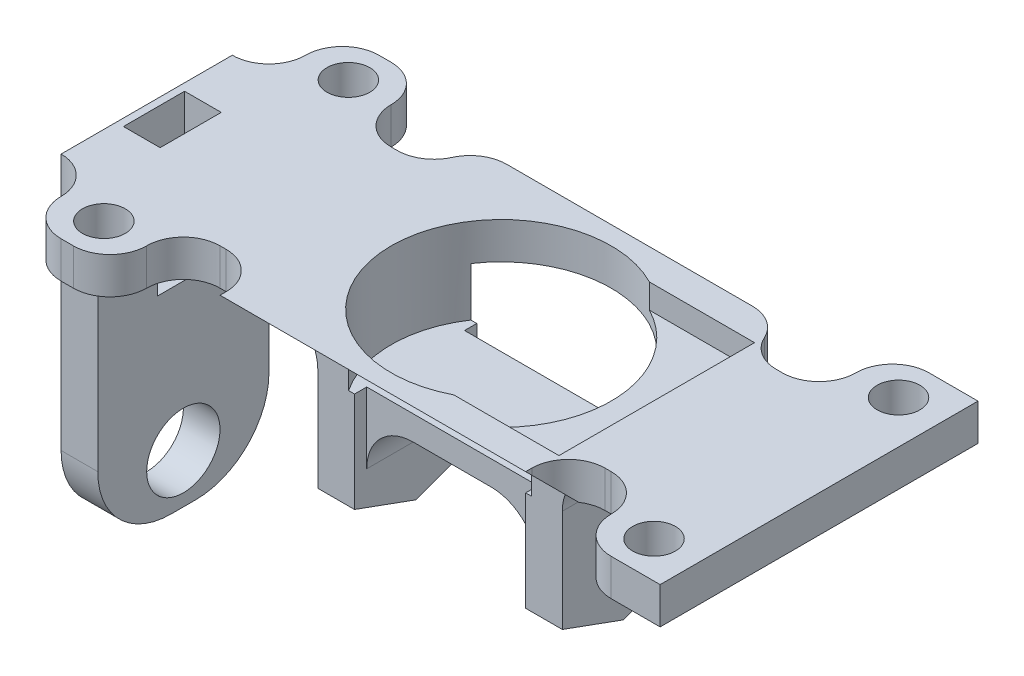
from build123d import *
from OCP.BRepFilletAPI import BRepFilletAPI_MakeChamfer

# Parameters (mm, degrees)
SKETCH1_W           = 3
SKETCH1_H           = 14
BOSS_EXTRUDE1_DEPTH = 27
SKETCH2_R           = 3
CUT_EXTRUDE1_DEPTH  = 29.053520278
SKETCH3_W           = 14
SKETCH3_H           = 3
BOSS_EXTRUDE2_DEPTH = 52
SKETCH4_W           = 3
SKETCH4_H           = 10
BOSS_EXTRUDE3_DEPTH = 14
CHAMFER1_SIZE       = 1.819851171
CHAMFER1_SIZE_2     = 5
SKETCH6_W           = 25
SKETCH6_H           = 3
BOSS_EXTRUDE5_DEPTH = 3.5
SKETCH5_W           = 7
SKETCH5_H           = 3
BOSS_EXTRUDE4_DEPTH = 6
SKETCH7_R           = 9
CUT_EXTRUDE2_DEPTH  = 7
CHAMFER2_SIZE       = 3
SKETCH8_W           = 8
SKETCH8_H           = 2
BOSS_EXTRUDE6_DEPTH = 14
SKETCH9_W           = 8.6
SKETCH9_H           = 16
CUT_EXTRUDE3_DEPTH  = 2
CUT_EXTRUDE4_REACH  = 63.321
SKETCH10_R          = 1.75
SKETCH11_W          = 1.8
SKETCH11_H          = 4.2
CUT_EXTRUDE5_DEPTH  = 11
FILLET1_R           = 3
FILLET2_R           = 3
FILLET3_R           = 3.8
FILLET4_R           = 6
SKETCH12_W          = 3
SKETCH12_H          = 5
CUT_EXTRUDE6_DEPTH  = 3


# Some blends are built 0.0001 mm under size
with BuildPart() as part:
    # Sketch1 → Boss-Extrude1 (new body)
    with BuildSketch(Plane(origin=(0, 0, 0), x_dir=(1, 0, 0), z_dir=(0, 1, 0))):
        Rectangle(SKETCH1_W, SKETCH1_H)
    extrude(amount=BOSS_EXTRUDE1_DEPTH)

    # Sketch2 → Cut-Extrude1 (cut, through all)
    with BuildSketch(Plane.ZY.offset(1.5)):
        with Locations((0, 4)):
            Circle(SKETCH2_R)
    extrude(amount=-CUT_EXTRUDE1_DEPTH, mode=Mode.SUBTRACT)

    # Sketch3 → Boss-Extrude2 (add)
    with BuildSketch(Plane(origin=(1.5, 0, 0), x_dir=(0, 0, -1), z_dir=(1, 0, 0))):
        with Locations((0, 25.5)):
            Rectangle(SKETCH3_W, SKETCH3_H)
    extrude(amount=BOSS_EXTRUDE2_DEPTH)

    # Sketch4 → Boss-Extrude3 (add)
    with BuildSketch(Plane.XZ.offset(-24)):
        with Locations((36, 0)):
            Rectangle(SKETCH4_W, SKETCH4_H)
        with Locations((19, 0)):
            Rectangle(SKETCH4_W, SKETCH4_H)
    extrude(amount=BOSS_EXTRUDE3_DEPTH)

    # Chamfer1
    chamfer1_edges_1 = [part.edges().sort_by_distance(p)[0] for p in [
        (36, 10, -5),
    ]]
    chamfer1_side_1 = [part.faces().sort_by_distance(p)[0] for p in [
        (36, 10.036397023, -5),
    ]]
    chamfer1_edges_2 = [part.edges().sort_by_distance(p)[0] for p in [
        (36, 10, 5),
    ]]
    chamfer1_side_2 = [part.faces().sort_by_distance(p)[0] for p in [
        (36, 10.036397023, 5),
    ]]
    chamfer1_edges_3 = [part.edges().sort_by_distance(p)[0] for p in [
        (19, 10, 5),
    ]]
    chamfer1_side_3 = [part.faces().sort_by_distance(p)[0] for p in [
        (19, 10.036397023, 5),
    ]]
    chamfer1_edges_4 = [part.edges().sort_by_distance(p)[0] for p in [
        (19, 10, -5),
    ]]
    chamfer1_side_4 = [part.faces().sort_by_distance(p)[0] for p in [
        (19, 10.036397023, -5),
    ]]
    chamfer1 = BRepFilletAPI_MakeChamfer(part.part.solid().wrapped)
    for e in chamfer1_edges_1:
        chamfer1.Add(CHAMFER1_SIZE - 0.0001, CHAMFER1_SIZE_2 - 0.0001, e.wrapped, chamfer1_side_1[0].wrapped)
    for e in chamfer1_edges_2:
        chamfer1.Add(CHAMFER1_SIZE - 0.0001, CHAMFER1_SIZE_2 - 0.0001, e.wrapped, chamfer1_side_2[0].wrapped)
    for e in chamfer1_edges_3:
        chamfer1.Add(CHAMFER1_SIZE - 0.0001, CHAMFER1_SIZE_2 - 0.0001, e.wrapped, chamfer1_side_3[0].wrapped)
    for e in chamfer1_edges_4:
        chamfer1.Add(CHAMFER1_SIZE - 0.0001, CHAMFER1_SIZE_2 - 0.0001, e.wrapped, chamfer1_side_4[0].wrapped)
    add(Compound.cast(chamfer1.Shape()), mode=Mode.REPLACE)  # a hair under: the kernel refuses the full size

    # Sketch6 → Boss-Extrude5 (add)
    with BuildSketch(Plane(origin=(0, 0, -7), x_dir=(-1, 0, 0), z_dir=(0, 0, -1))):
        with Locations((-27.5, 25.5)):
            Rectangle(SKETCH6_W, SKETCH6_H)
    boss_extrude5 = extrude(amount=BOSS_EXTRUDE5_DEPTH)

    # Sketch5 → Boss-Extrude4 (add)
    with BuildSketch(Plane.XY.offset(7)):
        with Locations((5, 25.5)):
            Rectangle(SKETCH5_W, SKETCH5_H)
        with Locations((50, 25.5)):
            Rectangle(SKETCH5_W, SKETCH5_H)
    boss_extrude4 = extrude(amount=BOSS_EXTRUDE4_DEPTH)

    # Mirror1: Boss-Extrude5, Boss-Extrude4 across plane
    add(boss_extrude5.mirror(Plane.XY))
    add(boss_extrude4.mirror(Plane.XY))

    # Sketch7 → Cut-Extrude2 (cut)
    with BuildSketch(Plane(origin=(0, 27, 0), x_dir=(1, 0, 0), z_dir=(0, 1, 0))):
        with Locations(Location((27.5, 0, 0), (0, 0, 270))):
            Circle(SKETCH7_R)
    extrude(amount=-CUT_EXTRUDE2_DEPTH, mode=Mode.SUBTRACT)

    # Chamfer2
    # the kernel refuses this chamfer: 3 mm, written as the material it takes off along each edge
    with BuildSketch(Plane(origin=(15, 24, 10.5), x_dir=(0, -0.027495876610586757, -0.9996219169112968), z_dir=(1, 0, 0))) as chamfer2_piece_1:
        Polygon((CHAMFER2_SIZE * 0.999621916911, CHAMFER2_SIZE * 0.0274958766106), (-CHAMFER2_SIZE * 0.0274958766106, CHAMFER2_SIZE * 0.999621916911), (0, 0), align=None)
    extrude(amount=25, mode=Mode.SUBTRACT)

    # Sketch8 → Boss-Extrude6 (add)
    with BuildSketch(Plane(origin=(20.5, 0, 0), x_dir=(0, 0, -1), z_dir=(1, 0, 0))):
        with Locations((0, 19)):
            Rectangle(SKETCH8_W, SKETCH8_H)
    extrude(amount=BOSS_EXTRUDE6_DEPTH)

    # Sketch9 → Cut-Extrude3 (cut)
    with BuildSketch(Plane(origin=(0, 27, 0), x_dir=(1, 0, 0), z_dir=(0, 1, 0))):
        with Locations((35.923105626, 0)):
            Rectangle(SKETCH9_W, SKETCH9_H)
    extrude(amount=-CUT_EXTRUDE3_DEPTH, mode=Mode.SUBTRACT)

    # Sketch10 → Cut-Extrude4 (cut, up to next)
    with BuildSketch(Plane(origin=(0, 27, 0), x_dir=(1, 0, 0), z_dir=(0, 1, 0)), mode=Mode.PRIVATE) as cut_extrude4_sk1:
        with Locations(Location((5, -10, 0), (0, 0, 270))):
            Circle(SKETCH10_R)
    cut_extrude4_tool1 = extrude(cut_extrude4_sk1.sketch, amount=-CUT_EXTRUDE4_REACH, mode=Mode.PRIVATE) & part.part
    # Sketch10 → Cut-Extrude4 (cut, up to next)
    with BuildSketch(Plane(origin=(0, 27, 0), x_dir=(1, 0, 0), z_dir=(0, 1, 0)), mode=Mode.PRIVATE) as cut_extrude4_sk2:
        with Locations(Location((50, -10, 0), (0, 0, 270))):
            Circle(SKETCH10_R)
    cut_extrude4_tool2 = extrude(cut_extrude4_sk2.sketch, amount=-CUT_EXTRUDE4_REACH, mode=Mode.PRIVATE) & part.part
    # Sketch10 → Cut-Extrude4 (cut, up to next)
    with BuildSketch(Plane(origin=(0, 27, 0), x_dir=(1, 0, 0), z_dir=(0, 1, 0)), mode=Mode.PRIVATE) as cut_extrude4_sk3:
        with Locations(Location((50, 10, 0), (0, 0, 270))):
            Circle(SKETCH10_R)
    cut_extrude4_tool3 = extrude(cut_extrude4_sk3.sketch, amount=-CUT_EXTRUDE4_REACH, mode=Mode.PRIVATE) & part.part
    # Sketch10 → Cut-Extrude4 (cut, up to next)
    with BuildSketch(Plane(origin=(0, 27, 0), x_dir=(1, 0, 0), z_dir=(0, 1, 0)), mode=Mode.PRIVATE) as cut_extrude4_sk4:
        with Locations(Location((5, 10, 0), (0, 0, 270))):
            Circle(SKETCH10_R)
    cut_extrude4_tool4 = extrude(cut_extrude4_sk4.sketch, amount=-CUT_EXTRUDE4_REACH, mode=Mode.PRIVATE) & part.part
    add(cut_extrude4_tool1.solids().sort_by_distance((5, 27, 10))[0], mode=Mode.SUBTRACT)
    add(cut_extrude4_tool2.solids().sort_by_distance((50, 27, 10))[0], mode=Mode.SUBTRACT)
    add(cut_extrude4_tool3.solids().sort_by_distance((50, 27, -10))[0], mode=Mode.SUBTRACT)
    add(cut_extrude4_tool4.solids().sort_by_distance((5, 27, -10))[0], mode=Mode.SUBTRACT)

    # Sketch11 → Cut-Extrude5 (cut)
    with BuildSketch(Plane(origin=(0, 27, 0), x_dir=(1, 0, 0), z_dir=(0, 1, 0))):
        with Locations((0.6, 0)):
            Rectangle(SKETCH11_W, SKETCH11_H)
    extrude(amount=-CUT_EXTRUDE5_DEPTH, mode=Mode.SUBTRACT)

    # Fillet1
    # the kernel refuses this fillet: 3 mm, written as the material it adds along each edge
    with BuildSketch(Plane(origin=(46.5, 24, 7), x_dir=(0, 0, 1), z_dir=(0, 1, 0)), Plane(origin=(8.5, 27, 7), x_dir=(0, 0, 1), z_dir=(0, -1, 0)), Plane(origin=(1.5, 24, 7), x_dir=(0, 0, 1), z_dir=(0, 1, 0)), Plane(origin=(46.5, 24, -7), x_dir=(-1, 0, 0), z_dir=(0, 1, 0))) as fillet1_piece_1:
        with BuildLine():
            CenterArc((FILLET1_R, -FILLET1_R), FILLET1_R, 90, 90)
            Line((0, -FILLET1_R), (0, 0))
            Line((0, 0), (FILLET1_R, 0))
        make_face()
    extrude(amount=3)
    with BuildSketch(Plane(origin=(40, 24, 7), x_dir=(1, 0, 0), z_dir=(0, 1, 0))) as fillet1_piece_2_section:
        with BuildLine():
            CenterArc((FILLET1_R, -FILLET1_R), FILLET1_R, 90, 90)
            Line((0, -FILLET1_R), (0, 0))
            Line((0, 0), (FILLET1_R, 0))
        make_face()
    fillet1_piece_2 = extrude(amount=8.5, mode=Mode.PRIVATE)
    fillet1_piece_2 = split(fillet1_piece_2, bisect_by=Plane(origin=(40.974089344, 24.187586332, 7.687586332), z_dir=(0, 0.7071067811862648, -0.7071067811868302)), keep=Keep.TOP, mode=Mode.PRIVATE)
    fillet1_piece_2 = split(fillet1_piece_2, bisect_by=Plane(origin=(40.974089344, 27, 7.348410065), z_dir=(0, -1, 0)), keep=Keep.TOP, mode=Mode.PRIVATE)
    fillet1_piece_2 = split(fillet1_piece_2, bisect_by=Plane(origin=(40.223105626, 24.526762599, 7.348410065), z_dir=(1, 0, 0)), keep=Keep.TOP, mode=Mode.PRIVATE)
    add(fillet1_piece_2)
    with BuildSketch(Plane(origin=(40, 24, 7), x_dir=(1, 0, 0), z_dir=(0, 1, 0))) as fillet1_piece_3_section:
        with BuildLine():
            CenterArc((FILLET1_R, -FILLET1_R), FILLET1_R, 90, 90)
            Line((0, -FILLET1_R), (0, 0))
            Line((0, 0), (FILLET1_R, 0))
        make_face()
    fillet1_piece_3 = extrude(amount=1, mode=Mode.PRIVATE)
    fillet1_piece_3 = split(fillet1_piece_3, bisect_by=Plane(origin=(40.111552813, 24.25, 7.75), z_dir=(0, 0.7071067811862648, -0.7071067811868302)), keep=Keep.TOP, mode=Mode.PRIVATE)
    add(fillet1_piece_3)
    with BuildSketch(Plane(origin=(40, 16.5, 7), x_dir=(1, 0, 0), z_dir=(0, 1, 0))) as fillet1_piece_4_section:
        with BuildLine():
            CenterArc((FILLET1_R, -FILLET1_R), FILLET1_R, 90, 90)
            Line((0, -FILLET1_R), (0, 0))
            Line((0, 0), (FILLET1_R, 0))
        make_face()
    fillet1_piece_4 = extrude(amount=16, mode=Mode.PRIVATE)
    fillet1_piece_4 = split(fillet1_piece_4, bisect_by=Plane(origin=(40.102150249, 25.589388324, 9.089388324), z_dir=(0, 0.7071067811862648, -0.7071067811868302)), keep=Keep.TOP, mode=Mode.PRIVATE)
    fillet1_piece_4 = split(fillet1_piece_4, bisect_by=Plane(origin=(40.102150249, 27, 8.580734209), z_dir=(0, -1, 0)), keep=Keep.TOP, mode=Mode.PRIVATE)
    fillet1_piece_4 = split(fillet1_piece_4, bisect_by=Plane(origin=(40.102150249, 26.098042439, 8), z_dir=(0, 0, 1)), keep=Keep.TOP, mode=Mode.PRIVATE)
    add(fillet1_piece_4)
    with BuildSketch(Plane(origin=(15, 27, 7), x_dir=(-1, 0, 0), z_dir=(0, -1, 0))) as fillet1_piece_5_section:
        with BuildLine():
            CenterArc((FILLET1_R, -FILLET1_R), FILLET1_R, 90, 90)
            Line((0, -FILLET1_R), (0, 0))
            Line((0, 0), (FILLET1_R, 0))
        make_face()
    fillet1_piece_5 = extrude(amount=3, mode=Mode.PRIVATE)
    fillet1_piece_5 = split(fillet1_piece_5, bisect_by=Plane(origin=(14.281357865, 24.846943588, 8.346943588), z_dir=(0, 0.7071067811862648, -0.7071067811868302)), keep=Keep.TOP, mode=Mode.PRIVATE)
    add(fillet1_piece_5)
    with BuildSketch(Plane(origin=(1.5, 24, -7), x_dir=(0, 0, -1), z_dir=(0, 1, 0)), Plane(origin=(8.5, 27, -7), x_dir=(0, 0, -1), z_dir=(0, -1, 0)), Plane(origin=(15, 27, -7), x_dir=(-1, 0, 0), z_dir=(0, -1, 0))) as fillet1_piece_6:
        with BuildLine():
            CenterArc((FILLET1_R, FILLET1_R), FILLET1_R, 180, 90)
            Line((0, FILLET1_R), (0, 0))
            Line((0, 0), (FILLET1_R, 0))
        make_face()
    extrude(amount=3)
    with BuildSketch(Plane(origin=(40, 24, -7), x_dir=(0, 0, -1), z_dir=(0, 1, 0))) as fillet1_piece_7_section:
        with BuildLine():
            CenterArc((FILLET1_R, -FILLET1_R), FILLET1_R, 90, 90)
            Line((0, -FILLET1_R), (0, 0))
            Line((0, 0), (FILLET1_R, 0))
        make_face()
    fillet1_piece_7 = extrude(amount=8.5, mode=Mode.PRIVATE)
    fillet1_piece_7 = split(fillet1_piece_7, bisect_by=Plane(origin=(40.097980222, 27, -8.647383522), z_dir=(0, -1, 0)), keep=Keep.TOP, mode=Mode.PRIVATE)
    fillet1_piece_7 = split(fillet1_piece_7, bisect_by=Plane(origin=(40.097980222, 24.5, -8), z_dir=(0, 0, -1)), keep=Keep.TOP, mode=Mode.PRIVATE)
    add(fillet1_piece_7)
    with BuildSketch(Plane(origin=(40, 24, -7), x_dir=(0, 0, -1), z_dir=(0, 1, 0))) as fillet1_piece_8:
        with BuildLine():
            CenterArc((FILLET1_R, -FILLET1_R), FILLET1_R, 90, 90)
            Line((0, -FILLET1_R), (0, 0))
            Line((0, 0), (FILLET1_R, 0))
        make_face()
    extrude(amount=1)
    with BuildSketch(Plane(origin=(40, 16.5, -7), x_dir=(0, 0, -1), z_dir=(0, 1, 0))) as fillet1_piece_9_section:
        with BuildLine():
            CenterArc((FILLET1_R, -FILLET1_R), FILLET1_R, 90, 90)
            Line((0, -FILLET1_R), (0, 0))
            Line((0, 0), (FILLET1_R, 0))
        make_face()
    fillet1_piece_9 = extrude(amount=16, mode=Mode.PRIVATE)
    fillet1_piece_9 = split(fillet1_piece_9, bisect_by=Plane(origin=(40.946316816, 27, -7.381877422), z_dir=(0, -1, 0)), keep=Keep.TOP, mode=Mode.PRIVATE)
    fillet1_piece_9 = split(fillet1_piece_9, bisect_by=Plane(origin=(40.946316816, 25, -7.381877422), z_dir=(0, 1, 0)), keep=Keep.TOP, mode=Mode.PRIVATE)
    fillet1_piece_9 = split(fillet1_piece_9, bisect_by=Plane(origin=(40.223105626, 26, -7.381877422), z_dir=(1, 0, 0)), keep=Keep.TOP, mode=Mode.PRIVATE)
    add(fillet1_piece_9)

    # Fillet2
    fillet2_edges = [part.edges().sort_by_distance(p)[0] for p in [
        (46.5, 25.5, 13),
        (46.5, 25.5, -13),
        (40, 25.5, -10.5),
        (15, 25.5, -10.5),
        (8.5, 25.5, 13),
        (1.5, 25.5, 13),
        (1.5, 25.5, -13),
        (8.5, 25.5, -13),
    ]]
    fillet(fillet2_edges, radius=FILLET2_R - 0.0001)  # a hair under: the kernel refuses the full size

    # Fillet3
    fillet3_edges = [part.edges().sort_by_distance(p)[0] for p in [
        (20.5, 18, 0),
        (34.5, 18, 0),
        (1.5, 24, 4.55),
        (1.5, 24, -4.55),
        (17.5, 24, 0),
        (37.5, 24, 0),
    ]]
    fillet(fillet3_edges, radius=FILLET3_R)

    # Fillet4
    fillet4_edges = [part.edges().sort_by_distance(p)[0] for p in [
        (0, 0, 7),
        (0, 0, -7),
    ]]
    fillet(fillet4_edges, radius=FILLET4_R)

    # Sketch12 → Cut-Extrude6 (cut)
    with BuildSketch(Plane(origin=(0, 27, 0), x_dir=(1, 0, 0), z_dir=(0, 1, 0))):
        with Locations((0.6, 0)):
            Rectangle(SKETCH12_W, SKETCH12_H)
    extrude(amount=-CUT_EXTRUDE6_DEPTH, mode=Mode.SUBTRACT)


solid = part.part
